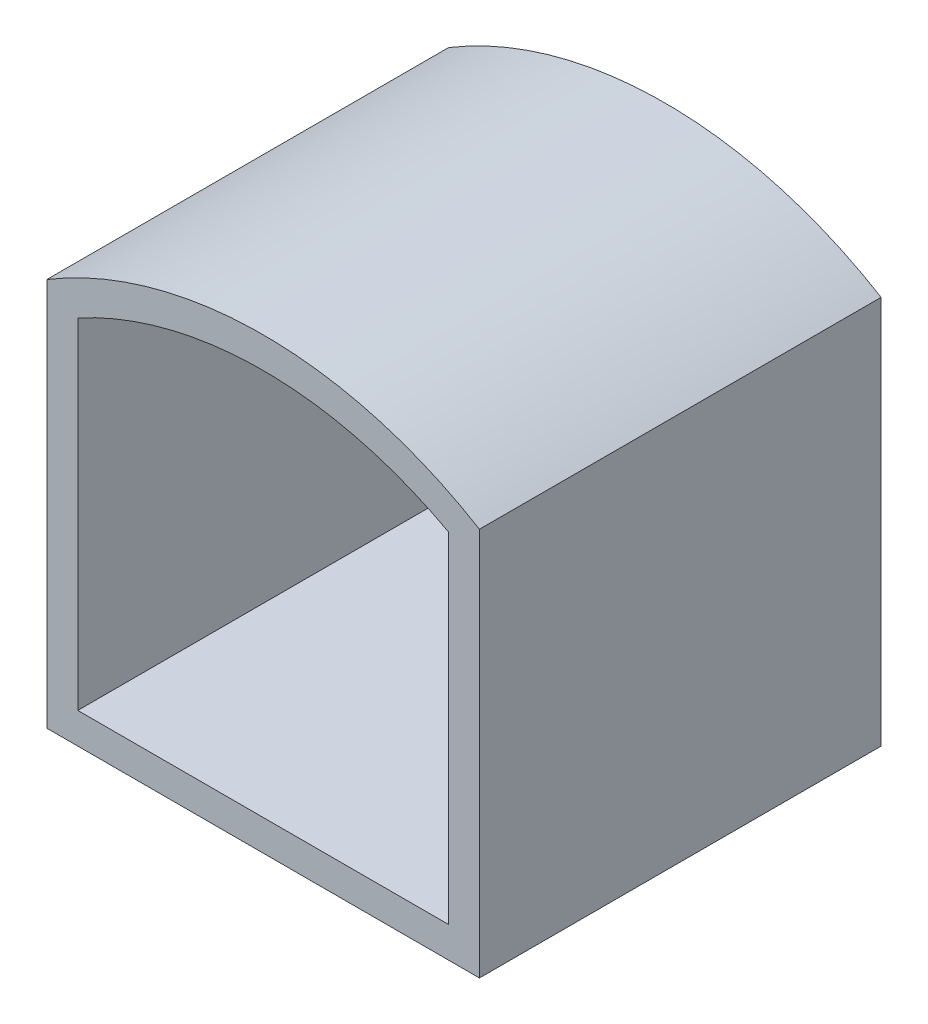
from build123d import *

# Parameters (mm, degrees)
BOSS_EXTRUDE1_DEPTH = 120
SHELL1_T            = 10


with BuildPart() as part:
    # Sketch1 → Boss-Extrude1 (new body)
    with BuildSketch(Plane.XY):
        with BuildLine():
            Line((60, -55), (-60, -55))
            Line((-60, -55), (-60, 55))
            ThreePointArc((-60, 55), (0, 70.299640861), (60, 55))
            Line((60, 55), (60, -55))
        make_face()
    extrude(amount=BOSS_EXTRUDE1_DEPTH)

    # Shell1
    shell1_openings = [part.faces().sort_by_distance(p)[0] for p in [
        (0, 5.250377589, 120),
    ]]
    offset(amount=SHELL1_T, openings=shell1_openings, kind=Kind.INTERSECTION)


solid = part.part
